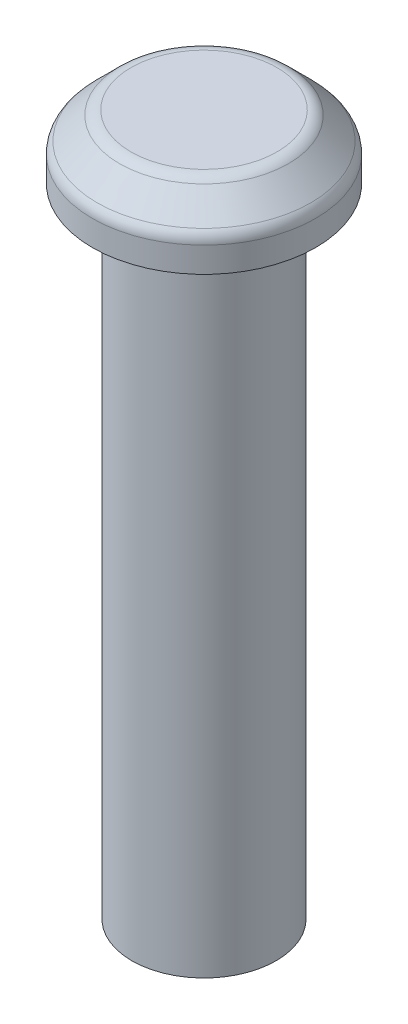
from build123d import *

# Parameters (mm, degrees)
SKETCH1_R           = 2.265
BOSS_EXTRUDE1_DEPTH = 20
SKETCH2_R           = 3.5
BOSS_EXTRUDE2_DEPTH = 2
CHAMFER1_SIZE       = 1
FILLET1_R           = 0.5


with BuildPart() as part:
    # Sketch1 → Boss-Extrude1 (new body)
    with BuildSketch(Plane(origin=(0, 0, 0), x_dir=(1, 0, 0), z_dir=(0, 1, 0))):
        Circle(SKETCH1_R)
    extrude(amount=BOSS_EXTRUDE1_DEPTH)

    # Sketch2 → Boss-Extrude2 (add)
    with BuildSketch(Plane(origin=(0, 20, 0), x_dir=(1, 0, 0), z_dir=(0, 1, 0))):
        Circle(SKETCH2_R)
    extrude(amount=BOSS_EXTRUDE2_DEPTH)

    # Chamfer1
    chamfer1_edges = [part.edges().sort_by_distance(p)[0] for p in [
        (-3.5, 22, 0),
    ]]
    chamfer(chamfer1_edges, length=CHAMFER1_SIZE)

    # Fillet1
    fillet1_edges = [part.edges().sort_by_distance(p)[0] for p in [
        (-3.5, 21, 0),
        (-2.5, 22, 0),
    ]]
    fillet(fillet1_edges, radius=FILLET1_R)


solid = part.part
